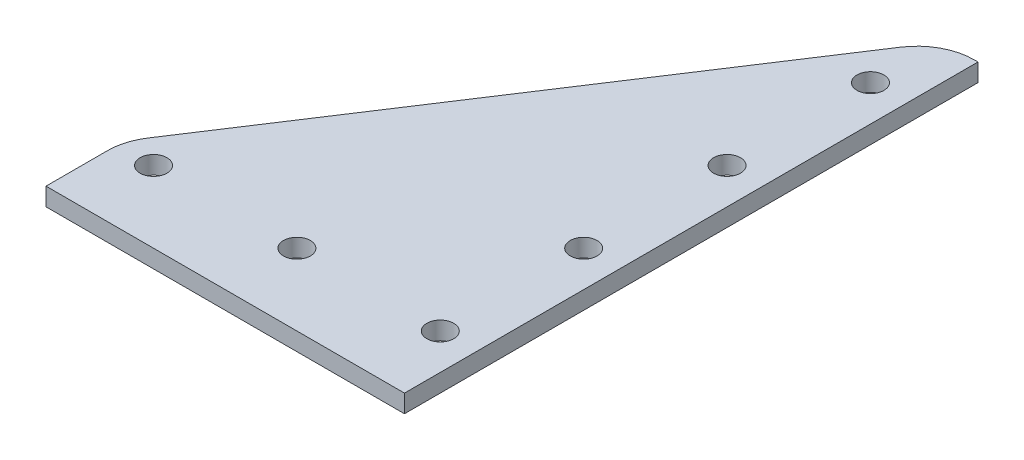
from build123d import *

# Parameters (mm, degrees)
SKETCH1_W           = 63.5
SKETCH1_H           = 101.6
BOSS_EXTRUDE1_DEPTH = 3.175
SKETCH2_R           = 2.38125
CUT_EXTRUDE1_DEPTH  = 3.175
CUT_EXTRUDE2_DEPTH  = 60.989858518
FILLET1_R           = 10.16


with BuildPart() as part:
    # Sketch1 → Boss-Extrude1 (new body)
    with BuildSketch(Plane(origin=(0, 0, 0), x_dir=(1, 0, 0), z_dir=(0, 1, 0))):
        Rectangle(SKETCH1_W, SKETCH1_H)
    extrude(amount=BOSS_EXTRUDE1_DEPTH)

    # Sketch2 → Cut-Extrude1 (cut)
    with BuildSketch(Plane(origin=(0, 3.175, 0), x_dir=(1, 0, 0), z_dir=(0, 1, 0))):
        with Locations((25.4, -38.1)):
            Circle(SKETCH2_R)
        with Locations((25.4, -12.7)):
            Circle(SKETCH2_R)
        with Locations((25.4, 12.7)):
            Circle(SKETCH2_R)
        with Locations((25.4, 38.1)):
            Circle(SKETCH2_R)
        with Locations((0, -38.1)):
            Circle(SKETCH2_R)
        with Locations((-25.4, -38.1)):
            Circle(SKETCH2_R)
        with Locations((-50.8, -38.1)):
            Circle(SKETCH2_R)
    extrude(amount=-CUT_EXTRUDE1_DEPTH, mode=Mode.SUBTRACT)

    # Sketch3 → Cut-Extrude2 (cut, through all)
    with BuildSketch(Plane(origin=(0, 3.175, 0), x_dir=(1, 0, 0), z_dir=(0, 1, 0))):
        Polygon((-31.75, -36.901306097), (25.618713935, 50.8), (-31.75, 50.8), align=None)
    extrude(amount=-CUT_EXTRUDE2_DEPTH, mode=Mode.SUBTRACT)

    # Fillet1
    fillet1_edges = [part.edges().sort_by_distance(p)[0] for p in [
        (-31.75, 1.5875, 36.901306097),
        (25.618713935, 1.5875, -50.8),
    ]]
    fillet(fillet1_edges, radius=FILLET1_R)


solid = part.part
